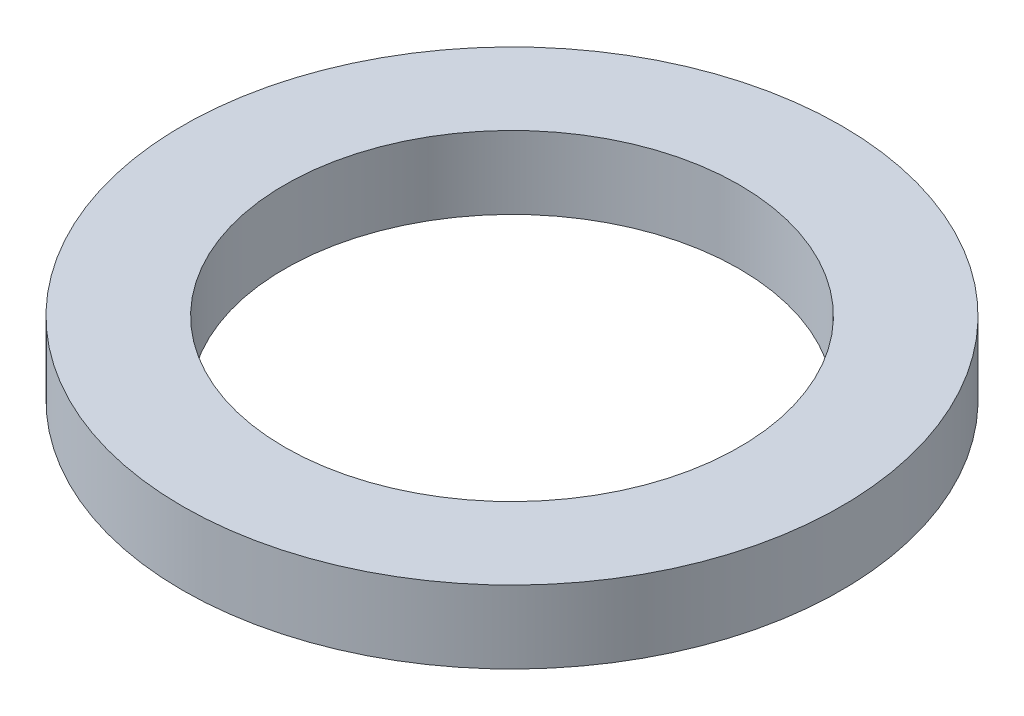
from build123d import *

# Parameters (mm, degrees)
SKETCH1_R           = 72.5
BOSS_EXTRUDE1_DEPTH = 16
SKETCH2_R           = 50
CUT_EXTRUDE1_DEPTH  = 104.771383339


with BuildPart() as part:
    # Sketch1 → Boss-Extrude1 (new body)
    with BuildSketch(Plane(origin=(0, 0, 0), x_dir=(1, 0, 0), z_dir=(0, 1, 0))):
        Circle(SKETCH1_R)
    extrude(amount=BOSS_EXTRUDE1_DEPTH)

    # Sketch2 → Cut-Extrude1 (cut, through all)
    with BuildSketch(Plane(origin=(0, 0, 0), x_dir=(1, 0, 0), z_dir=(0, 1, 0))):
        Circle(SKETCH2_R)
    extrude(amount=CUT_EXTRUDE1_DEPTH, mode=Mode.SUBTRACT)


solid = part.part
